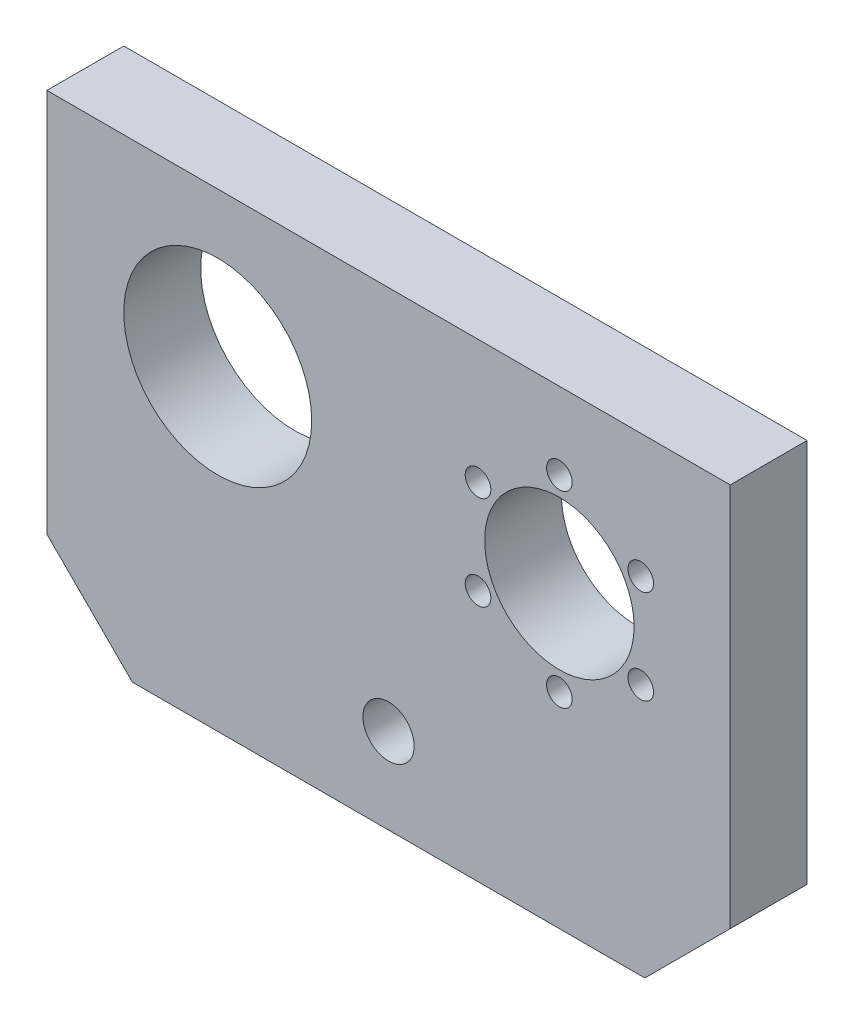
from build123d import *

# Parameters (mm, degrees)
ESQUISSE1_W             = 80
ESQUISSE1_H             = 55
BOSS_EXTRU_1_DEPTH      = 9
ESQUISSE2_R             = 11
ESQUISSE2_R_2           = 8.75
ESQUISSE2_R_3           = 1.5
ENL_V_MAT_EXTRU_1_DEPTH = 98.49871794
ESQUISSE3_R             = 3
ENL_V_MAT_EXTRU_2_DEPTH = 98.49871794
CHANFREIN1_SIZE         = 10


with BuildPart() as part:
    # Esquisse1 → Boss.-Extru.1 (new body)
    with BuildSketch(Plane.XY):
        with Locations((40, 27.5)):
            Rectangle(ESQUISSE1_W, ESQUISSE1_H)
    extrude(amount=BOSS_EXTRU_1_DEPTH)

    # Esquisse2 → Enlèv. mat.-Extru.1 (cut, through all)
    with BuildSketch(Plane.XY.offset(9)):
        with Locations((20, 37)):
            Circle(ESQUISSE2_R)
        with Locations((60, 35)):
            Circle(ESQUISSE2_R_2)
        with Locations((60, 46)):
            Circle(ESQUISSE2_R_3)
        with Locations((69.526279442, 40.5)):
            Circle(ESQUISSE2_R_3)
        with Locations((69.526279442, 29.5)):
            Circle(ESQUISSE2_R_3)
        with Locations((60, 24)):
            Circle(ESQUISSE2_R_3)
        with Locations((50.473720558, 29.5)):
            Circle(ESQUISSE2_R_3)
        with Locations((50.473720558, 40.5)):
            Circle(ESQUISSE2_R_3)
    extrude(amount=-ENL_V_MAT_EXTRU_1_DEPTH, mode=Mode.SUBTRACT)

    # Esquisse3 → Enlèv. mat.-Extru.2 (cut, through all)
    with BuildSketch(Plane.XY.offset(9)):
        with Locations((40, 10)):
            Circle(ESQUISSE3_R)
    extrude(amount=-ENL_V_MAT_EXTRU_2_DEPTH, mode=Mode.SUBTRACT)

    # Chanfrein1
    chanfrein1_edges = [part.edges().sort_by_distance(p)[0] for p in [
        (80, 0, 4.5),
        (0, 0, 4.5),
    ]]
    chamfer(chanfrein1_edges, length=CHANFREIN1_SIZE)


solid = part.part
